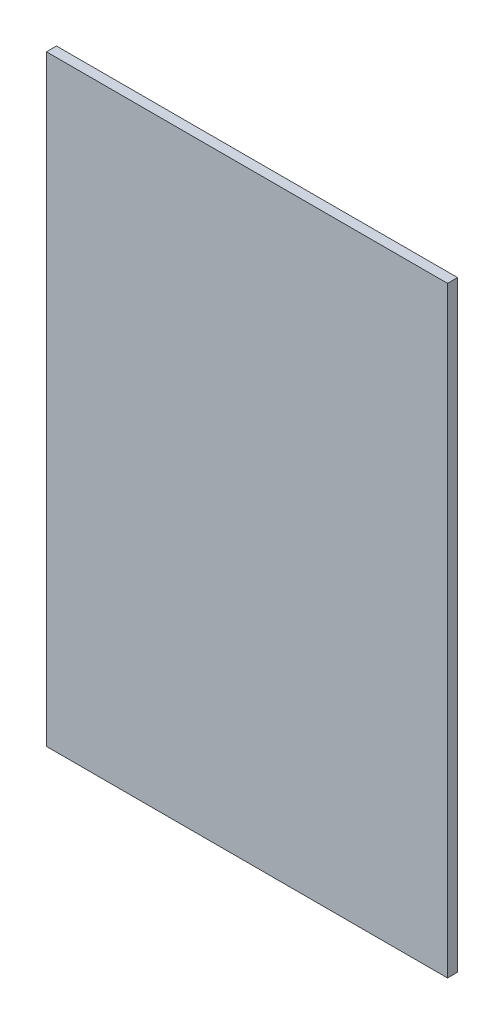
from build123d import *

# Parameters (mm, degrees)
ESQUISSE1_W        = 400
ESQUISSE1_H        = 600
BOSS_EXTRU_1_DEPTH = 10


with BuildPart() as part:
    # Esquisse1 → Boss.-Extru.1 (new body)
    with BuildSketch(Plane.XY):
        with Locations((-200, 300)):
            Rectangle(ESQUISSE1_W, ESQUISSE1_H)
    extrude(amount=-BOSS_EXTRU_1_DEPTH)


solid = part.part
